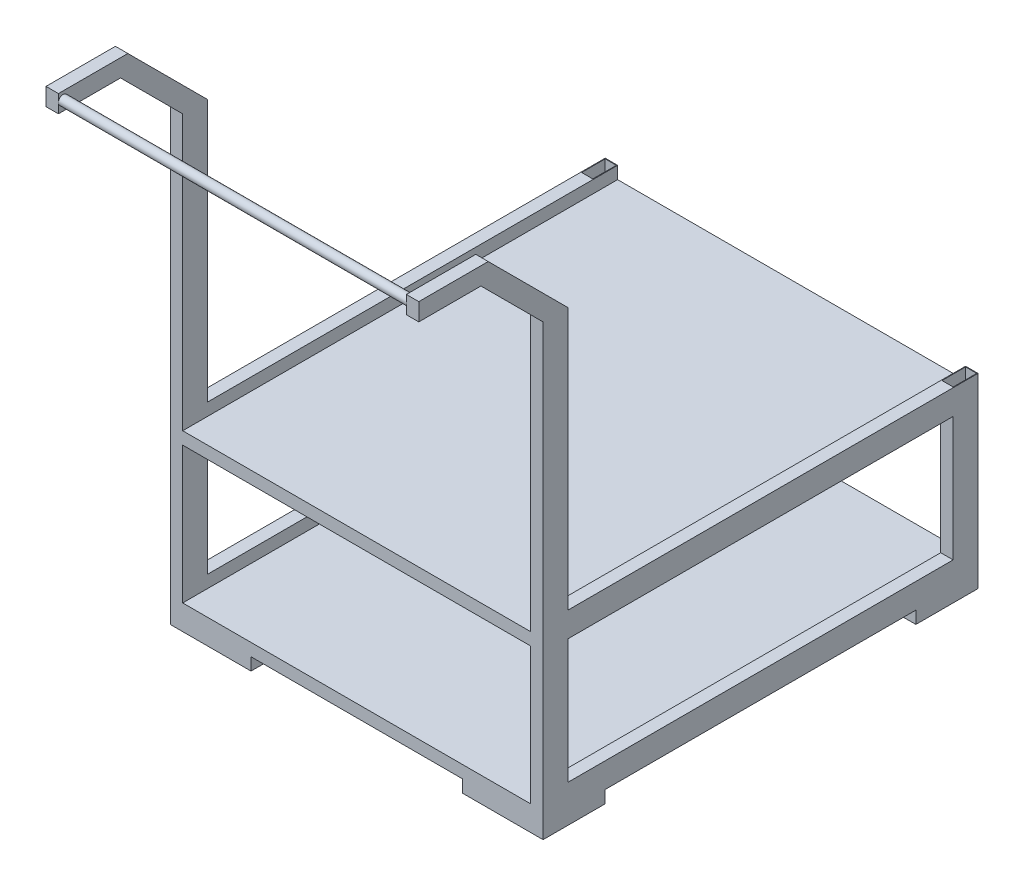
from build123d import *

# Parameters (mm, degrees)
EXTRUDE_THIN1_START             = 100
EXTRUDE_THIN1_OUTLINE_W         = 20
EXTRUDE_THIN1_OUTLINE_H         = 40
EXTRUDE_THIN1_OUTLINE_W_2       = 18
EXTRUDE_THIN1_OUTLINE_H_2       = 38
EXTRUDE_THIN1_DEPTH             = 701.72
SKETCH5_W                       = 20
SKETCH5_H                       = 40
SKETCH5_W_2                     = 18
SKETCH5_H_2                     = 38
EXTRUDE_THIN2_DEPTH             = 620
SKETCH6_W                       = 20
SKETCH6_H                       = 421.72
CUT_EXTRUDE1_DEPTH              = 1081.904694411
BOSS_EXTRUDE1_REACH             = 1107.783
SKETCH8_W                       = 700
SKETCH8_H                       = 20
BOSS_EXTRUDE1_DIRECTION_2_REACH = 1107.783
BOSS_EXTRUDE2_REACH             = 1214.087
SKETCH9_W                       = 700
SKETCH9_H                       = 20
BOSS_EXTRUDE3_DEPTH             = 20
BOSS_EXTRUDE4_DEPTH             = 20
BOSS_EXTRUDE5_REACH             = 1311.545
SKETCH12_R                      = 7.5
SKETCH16_W                      = 130
SKETCH16_H                      = 100
BOSS_EXTRUDE6_DEPTH             = 20


# Read off the part's stored shape, not the designer's step: Extrude-Thin1
with BuildPart() as part:
    # Extrude-Thin1 outline → Extrude-Thin1 (new body)
    # profile 1 of 4: a face of its own
    with BuildSketch(Plane(origin=(0, 0, 0), x_dir=(1, 0, 0), z_dir=(0, 1, 0)).offset(EXTRUDE_THIN1_START)):
        with Locations((-290, 680)):
            Rectangle(EXTRUDE_THIN1_OUTLINE_W, EXTRUDE_THIN1_OUTLINE_H)
        with Locations((-290, 680)):
            Rectangle(EXTRUDE_THIN1_OUTLINE_W_2, EXTRUDE_THIN1_OUTLINE_H_2, mode=Mode.SUBTRACT)
    # profile 2 of 4: a face of its own
    with BuildSketch(Plane(origin=(0, 0, 0), x_dir=(1, 0, 0), z_dir=(0, 1, 0)).offset(EXTRUDE_THIN1_START)):
        with Locations((290, 680)):
            Rectangle(EXTRUDE_THIN1_OUTLINE_W, EXTRUDE_THIN1_OUTLINE_H)
        with Locations((290, 680)):
            Rectangle(EXTRUDE_THIN1_OUTLINE_W_2, EXTRUDE_THIN1_OUTLINE_H_2, mode=Mode.SUBTRACT)
    # profile 3 of 4: a face of its own
    with BuildSketch(Plane(origin=(0, 0, 0), x_dir=(1, 0, 0), z_dir=(0, 1, 0)).offset(EXTRUDE_THIN1_START)):
        with Locations((290, 20)):
            Rectangle(EXTRUDE_THIN1_OUTLINE_W, EXTRUDE_THIN1_OUTLINE_H)
        with Locations((290, 20)):
            Rectangle(EXTRUDE_THIN1_OUTLINE_W_2, EXTRUDE_THIN1_OUTLINE_H_2, mode=Mode.SUBTRACT)
    # profile 4 of 4: a face of its own
    with BuildSketch(Plane(origin=(0, 0, 0), x_dir=(1, 0, 0), z_dir=(0, 1, 0)).offset(EXTRUDE_THIN1_START)):
        with Locations((-290, 20)):
            Rectangle(EXTRUDE_THIN1_OUTLINE_W, EXTRUDE_THIN1_OUTLINE_H)
        with Locations((-290, 20)):
            Rectangle(EXTRUDE_THIN1_OUTLINE_W_2, EXTRUDE_THIN1_OUTLINE_H_2, mode=Mode.SUBTRACT)
    extrude(amount=EXTRUDE_THIN1_DEPTH)

    # Sketch5 → Extrude-Thin2 (add)
    # profile 1 of 4: a face of its own
    with BuildSketch(Plane.XY.offset(-660)):
        with Locations((-290, 360)):
            Rectangle(SKETCH5_W, SKETCH5_H)
        with Locations((-290, 360)):
            Rectangle(SKETCH5_W_2, SKETCH5_H_2, mode=Mode.SUBTRACT)
    # profile 2 of 4: a face of its own
    with BuildSketch(Plane.XY.offset(-660)):
        with Locations((290, 360)):
            Rectangle(SKETCH5_W, SKETCH5_H)
        with Locations((290, 360)):
            Rectangle(SKETCH5_W_2, SKETCH5_H_2, mode=Mode.SUBTRACT)
    # profile 3 of 4: a face of its own
    with BuildSketch(Plane.XY.offset(-660)):
        with Locations((-290, 120)):
            Rectangle(SKETCH5_W, SKETCH5_H)
        with Locations((-290, 120)):
            Rectangle(SKETCH5_W_2, SKETCH5_H_2, mode=Mode.SUBTRACT)
    # profile 4 of 4: a face of its own
    with BuildSketch(Plane.XY.offset(-660)):
        with Locations((290, 120)):
            Rectangle(SKETCH5_W, SKETCH5_H)
        with Locations((290, 120)):
            Rectangle(SKETCH5_W_2, SKETCH5_H_2, mode=Mode.SUBTRACT)
    extrude(amount=EXTRUDE_THIN2_DEPTH)

    # Sketch6 → Cut-Extrude1 (cut, through all)
    with BuildSketch(Plane.XY.offset(-660)):
        with Locations((290, 590.86)):
            Rectangle(SKETCH6_W, SKETCH6_H)
        with Locations((-290, 590.86)):
            Rectangle(SKETCH6_W, SKETCH6_H)
    extrude(amount=-CUT_EXTRUDE1_DEPTH, mode=Mode.SUBTRACT)

    # Sketch8 → Boss-Extrude1 (add, up to next)
    with BuildSketch(Plane(origin=(0, 0, 0), x_dir=(0, 0, -1), z_dir=(1, 0, 0)), mode=Mode.PRIVATE) as boss_extrude1_sk1:
        with Locations((350, 350)):
            Rectangle(SKETCH8_W, SKETCH8_H)
    boss_extrude1_tool1 = extrude(boss_extrude1_sk1.sketch, amount=BOSS_EXTRUDE1_REACH, mode=Mode.PRIVATE) - part.part
    add(boss_extrude1_tool1.solids().sort_by_distance((0, 350, -350))[0])

    # Sketch8 → Boss-Extrude1 direction 2 (add, up to next)
    with BuildSketch(Plane(origin=(0, 0, 0), x_dir=(0, 0, -1), z_dir=(1, 0, 0)), mode=Mode.PRIVATE) as boss_extrude1_direction_2_sk1:
        with Locations((350, 350)):
            Rectangle(SKETCH8_W, SKETCH8_H)
    boss_extrude1_direction_2_tool1 = extrude(boss_extrude1_direction_2_sk1.sketch, amount=-BOSS_EXTRUDE1_DIRECTION_2_REACH, mode=Mode.PRIVATE) - part.part
    add(boss_extrude1_direction_2_tool1.solids().sort_by_distance((0, 350, -350))[0])

    # Sketch9 → Boss-Extrude2 (add, up to next)
    with BuildSketch(Plane.ZY.offset(-280), mode=Mode.PRIVATE) as boss_extrude2_sk1:
        with Locations((-350, 110)):
            Rectangle(SKETCH9_W, SKETCH9_H)
    boss_extrude2_tool1 = extrude(boss_extrude2_sk1.sketch, amount=BOSS_EXTRUDE2_REACH, mode=Mode.PRIVATE) - part.part
    add(boss_extrude2_tool1.solids().sort_by_distance((280, 110, -350))[0])

    # Sketch10 → Boss-Extrude3 (add)
    with BuildSketch(Plane(origin=(300, 0, 0), x_dir=(0, 0, -1), z_dir=(1, 0, 0))):
        Polygon((-200, 901.72), (-100, 901.72), (0, 801.72), (40, 801.72), (-88.284271247, 930.004271247), (-200, 930.004271247), align=None)
    extrude(amount=-BOSS_EXTRUDE3_DEPTH)

    # Sketch11 → Boss-Extrude4 (add)
    with BuildSketch(Plane.ZY.offset(300)):
        Polygon((-40, 801.72), (0, 801.72), (100, 901.72), (200, 901.72), (200, 930.004271247), (88.284271247, 930.004271247), align=None)
    extrude(amount=-BOSS_EXTRUDE4_DEPTH)

    # Sketch12 → Boss-Extrude5 (add, up to next)
    with BuildSketch(Plane(origin=(300, 0, 0), x_dir=(0, 0, -1), z_dir=(1, 0, 0)), mode=Mode.PRIVATE) as boss_extrude5_sk1:
        with Locations(Location((-192.5, 917.504271247, 0), (0, 0, 180))):
            Circle(SKETCH12_R)
    boss_extrude5_tool1 = extrude(boss_extrude5_sk1.sketch, amount=-BOSS_EXTRUDE5_REACH, mode=Mode.PRIVATE) - part.part
    add(boss_extrude5_tool1.solids().sort_by_distance((300, 917.504271, 192.5))[0])

    # Sketch16 → Boss-Extrude6 (add)
    with BuildSketch(Plane.XZ.offset(-100)):
        with Locations((-235, -50)):
            Rectangle(SKETCH16_W, SKETCH16_H)
        with Locations((235, -50)):
            Rectangle(SKETCH16_W, SKETCH16_H)
        with Locations((235, -650)):
            Rectangle(SKETCH16_W, SKETCH16_H)
        with Locations((-235, -650)):
            Rectangle(SKETCH16_W, SKETCH16_H)
    extrude(amount=BOSS_EXTRUDE6_DEPTH)


solid = part.part
